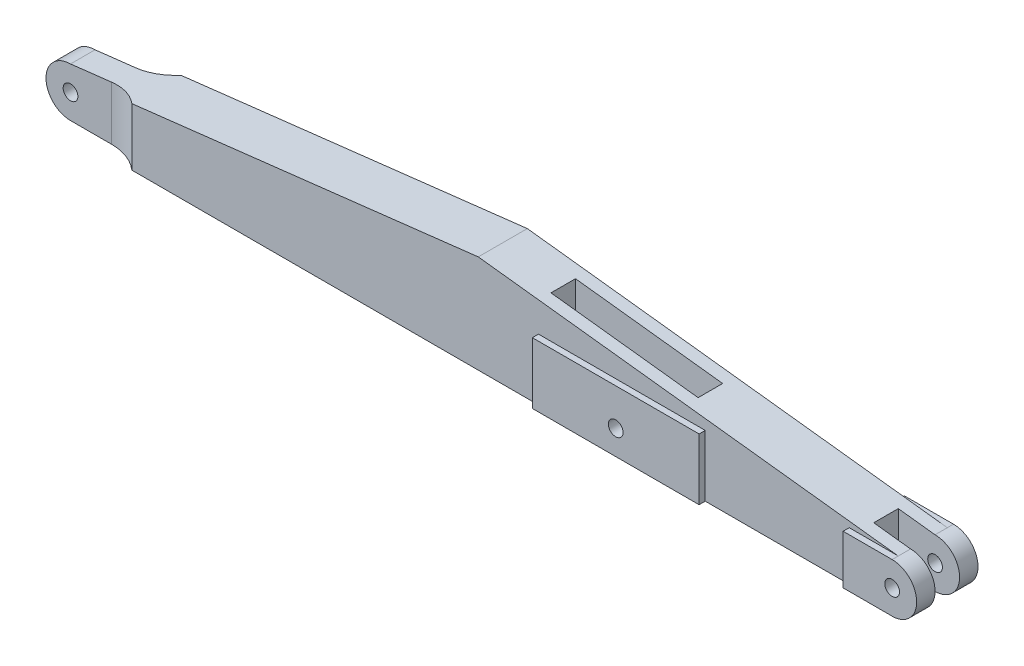
from build123d import *

# Parameters (mm, degrees)
CROQUIS1_R              = 1.5
SALIENTE_EXTRUIR1_DEPTH = 10
CROQUIS2_R              = 1.5
CROQUIS2_W              = 34
CROQUIS2_H              = 12.5
SALIENTE_EXTRUIR2_DEPTH = 6.25
CROQUIS3_W              = 25
CROQUIS3_H              = 5
CORTAR_EXTRUIR1_DEPTH   = 15
CROQUIS4_W              = 30
CROQUIS4_H              = 5
CORTAR_EXTRUIR2_DEPTH   = 30
CROQUIS6_W              = 40
CROQUIS6_H              = 7.662708713
CORTAR_EXTRUIR3_DEPTH   = 60
REDONDEO1_R             = 10


with BuildPart() as part:
    # Croquis1 → Saliente-Extruir1 (new body)
    with BuildSketch(Plane.XY):
        with BuildLine():
            Line((0, -5), (171.25, -5))
            ThreePointArc((171.25, -5), (176.25, 0), (171.25, 5))
            Line((171.25, 5), (85.625, 15))
            Line((85.625, 15), (0, 5))
            ThreePointArc((0, 5), (-5, 0), (0, -5))
        make_face()
        with Locations((171.25, 0)):
            Circle(CROQUIS1_R, mode=Mode.SUBTRACT)
        Circle(CROQUIS1_R, mode=Mode.SUBTRACT)
        with Locations((114.8954508, 0)):
            Circle(CROQUIS1_R, mode=Mode.SUBTRACT)
    extrude(amount=SALIENTE_EXTRUIR1_DEPTH)

    # Croquis2 → Saliente-Extruir2 (add, symmetric)
    # profile 1 of 2: a face of its own
    with BuildSketch(Plane.XY.offset(5)):
        with BuildLine():
            Line((171.25, 5), (161.25, 5))
            Line((161.25, 5), (161.25, -5))
            Line((161.25, -5), (171.25, -5))
            ThreePointArc((171.25, -5), (176.25, 0), (171.25, 5))
        make_face()
        with Locations((171.25, 0)):
            Circle(CROQUIS2_R, mode=Mode.SUBTRACT)
    # profile 2 of 2: a face of its own
    with BuildSketch(Plane.XY.offset(5)):
        with Locations((114.8954508, 1.25)):
            Rectangle(CROQUIS2_W, CROQUIS2_H)
        with Locations((114.8954508, 0)):
            Circle(CROQUIS2_R, mode=Mode.SUBTRACT)
    extrude(amount=SALIENTE_EXTRUIR2_DEPTH, both=True)

    # Croquis3 → Cortar-Extruir1 (cut)
    with BuildSketch(Plane.XZ.offset(5)):
        with Locations((176.25, 5)):
            Rectangle(CROQUIS3_W, CROQUIS3_H)
    extrude(amount=-CORTAR_EXTRUIR1_DEPTH, mode=Mode.SUBTRACT)

    # Croquis4 → Cortar-Extruir2 (cut)
    with BuildSketch(Plane.XZ.offset(5)):
        with Locations((112.94374, 5)):
            Rectangle(CROQUIS4_W, CROQUIS4_H)
    extrude(amount=-CORTAR_EXTRUIR2_DEPTH, mode=Mode.SUBTRACT)

    # Croquis6 → Cortar-Extruir3 (cut)
    with BuildSketch(Plane.XZ.offset(5)):
        with Locations((-5, 11.331354357)):
            Rectangle(CROQUIS6_W, CROQUIS6_H)
        with Locations((-5, -1.331354357)):
            Rectangle(CROQUIS6_W, CROQUIS6_H)
    extrude(amount=-CORTAR_EXTRUIR3_DEPTH, mode=Mode.SUBTRACT)

    # Redondeo1
    # the kernel refuses this fillet: 10 mm, written as the material it adds along each edge
    with BuildSketch(Plane(origin=(15, -5, 2.5), x_dir=(-1, 0, 0), z_dir=(0, 1, 0))) as redondeo1_piece_1_section:
        with BuildLine():
            CenterArc((6.614378278, -10), REDONDEO1_R, 90, 41.409622109)
            Line((0, -2.5), (-0.132287566, -2.35))
            ThreePointArc((-0.132287566, -2.35), (-0.2, -1.25), (-0.2, 0))
            Line((-0.2, 0), (0, 0.2))
            Line((0, 0.2), (6.614378278, 0.2))
            Line((6.614378278, 0.2), (6.614378278, 0))
        make_face()
    redondeo1_piece_1 = extrude(amount=28.287770512, mode=Mode.PRIVATE)
    redondeo1_piece_1 = split(redondeo1_piece_1, bisect_by=Plane(origin=(12.547080383, 6.465352453, 1.89633879), z_dir=(0.11599990937510621, -0.9932492240243469, 0)), keep=Keep.TOP, mode=Mode.PRIVATE)
    add(redondeo1_piece_1)
    with BuildSketch(Plane(origin=(15, -5, 7.5), x_dir=(0, 0, 1), z_dir=(0, 1, 0))) as redondeo1_piece_2_section:
        with BuildLine():
            CenterArc((10, -6.614378278), REDONDEO1_R, 138.590377891, 41.409622109)
            Line((0, -6.614378278), (-0.2, -6.614378278))
            Line((-0.2, -6.614378278), (-0.2, 0))
            Line((-0.2, 0), (0, 0.2))
            ThreePointArc((0, 0.2), (1.25, 0.2), (2.35, 0.132287566))
            Line((2.35, 0.132287566), (2.5, 0))
        make_face()
    redondeo1_piece_2 = extrude(amount=28.287770512, mode=Mode.PRIVATE)
    redondeo1_piece_2 = split(redondeo1_piece_2, bisect_by=Plane(origin=(12.547080383, 6.465352453, 8.10366121), z_dir=(0.11599990937510621, -0.9932492240243469, 0)), keep=Keep.TOP, mode=Mode.PRIVATE)
    add(redondeo1_piece_2)


solid = part.part
